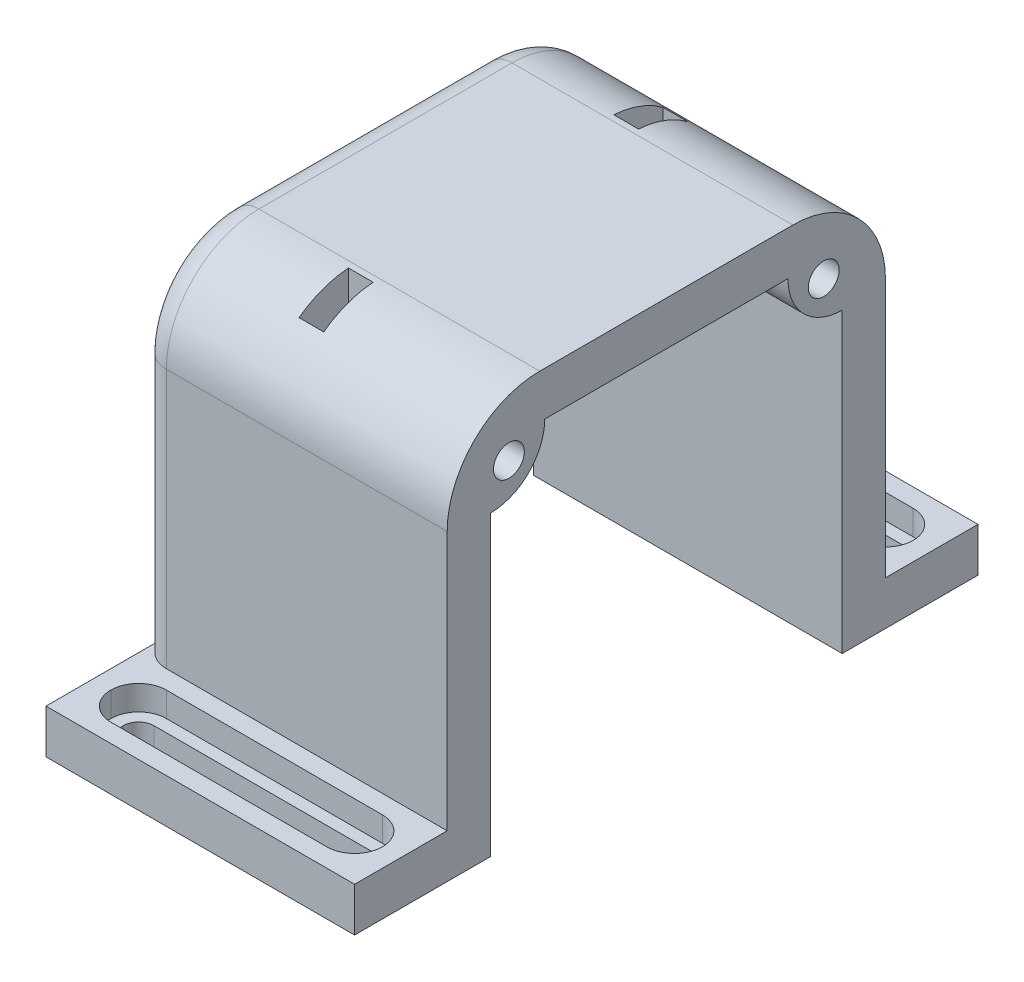
from build123d import *

# Parameters (mm, degrees)
BOSS_EXTRUDE1_DEPTH = 50
SKETCH2_R           = 2.5
CUT_EXTRUDE1_DEPTH  = 50
FILLET1_R           = 15
SKETCH3_W           = 4
SKETCH3_H           = 8
CUT_EXTRUDE2_DEPTH  = 14.54
SKETCH4_W           = 44
SKETCH4_H           = 9
CUT_EXTRUDE3_DEPTH  = 4
SKETCH5_W           = 40
SKETCH5_H           = 5
CUT_EXTRUDE4_DEPTH  = 94.654951818
FILLET2_R           = 2.5
FILLET3_R           = 4.5
FILLET4_R           = 4.5


with BuildPart() as part:
    # Sketch1 → Boss-Extrude1 (new body)
    with BuildSketch(Plane(origin=(0, 0, 0), x_dir=(0, 0, -1), z_dir=(1, 0, 0))):
        with BuildLine():
            Line((35.5, 35.62933491), (-35.5, 35.62933491))
            Line((-35.5, 35.62933491), (-35.5, -21.37066509))
            Line((-35.5, -21.37066509), (-50.5, -21.37066509))
            Line((-50.5, -21.37066509), (-50.5, -28.5))
            Line((-50.5, -28.5), (-28.5, -28.5))
            Line((-28.5, -28.5), (-28.5, 19.7))
            ThreePointArc((-28.5, 19.7), (-22.277460326, 22.277460326), (-19.7, 28.5))
            Line((-19.7, 28.5), (19.7, 28.5))
            ThreePointArc((19.7, 28.5), (22.277460326, 22.277460326), (28.5, 19.7))
            Line((28.5, 19.7), (28.5, -28.5))
            Line((28.5, -28.5), (50.5, -28.5))
            Line((50.5, -28.5), (50.5, -21.37066509))
            Line((50.5, -21.37066509), (35.5, -21.37066509))
            Line((35.5, -21.37066509), (35.5, 35.62933491))
        make_face()
    extrude(amount=BOSS_EXTRUDE1_DEPTH)

    # Sketch2 → Cut-Extrude1 (cut)
    with BuildSketch(Plane.ZY):
        with Locations((-25.5, 25.592902541)):
            Circle(SKETCH2_R)
        with Locations(Location((25.5, 25.592902541, 0), (0, 0, 180))):
            Circle(SKETCH2_R)
    extrude(amount=-CUT_EXTRUDE1_DEPTH, mode=Mode.SUBTRACT)

    # Fillet1
    fillet1_edges = [part.edges().sort_by_distance(p)[0] for p in [
        (25, 35.62933491, 35.5),
        (25, 35.62933491, -35.5),
    ]]
    fillet(fillet1_edges, radius=FILLET1_R)

    # Sketch3 → Cut-Extrude2 (cut)
    with BuildSketch(Plane(origin=(0, 35.62933491, 0), x_dir=(1, 0, 0), z_dir=(0, 1, 0))):
        with Locations((22, 25.5)):
            Rectangle(SKETCH3_W, SKETCH3_H)
        with Locations((22, -25.5)):
            Rectangle(SKETCH3_W, SKETCH3_H)
    extrude(amount=-CUT_EXTRUDE2_DEPTH, mode=Mode.SUBTRACT)

    # Sketch4 → Cut-Extrude3 (cut)
    with BuildSketch(Plane(origin=(0, -21.37066509, 0), x_dir=(1, 0, 0), z_dir=(0, 1, 0))):
        with Locations((25, -43)):
            Rectangle(SKETCH4_W, SKETCH4_H)
        with Locations((25, 43)):
            Rectangle(SKETCH4_W, SKETCH4_H)
    extrude(amount=-CUT_EXTRUDE3_DEPTH, mode=Mode.SUBTRACT)

    # Sketch5 → Cut-Extrude4 (cut, through all)
    with BuildSketch(Plane(origin=(0, -25.37066509, 0), x_dir=(1, 0, 0), z_dir=(0, 1, 0))):
        with Locations((25, -43)):
            Rectangle(SKETCH5_W, SKETCH5_H)
        with Locations((25, 43)):
            Rectangle(SKETCH5_W, SKETCH5_H)
    extrude(amount=-CUT_EXTRUDE4_DEPTH, mode=Mode.SUBTRACT)

    # Fillet2
    fillet2_edges = [part.edges().sort_by_distance(p)[0] for p in [
        (45, -26.935332545, 40.5),
        (45, -26.935332545, 45.5),
        (5, -26.935332545, 45.5),
        (5, -26.935332545, 40.5),
        (5, -26.935332545, -45.5),
        (5, -26.935332545, -40.5),
        (45, -26.935332545, -45.5),
        (45, -26.935332545, -40.5),
    ]]
    fillet(fillet2_edges, radius=FILLET2_R - 0.0001)  # a hair under: the kernel refuses the full size

    # Fillet3
    fillet3_edges = [part.edges().sort_by_distance(p)[0] for p in [
        (3, -23.37066509, 38.5),
        (3, -23.37066509, 47.5),
        (47, -23.37066509, 47.5),
        (47, -23.37066509, 38.5),
        (47, -23.37066509, -47.5),
        (47, -23.37066509, -38.5),
        (3, -23.37066509, -47.5),
        (3, -23.37066509, -38.5),
    ]]
    fillet(fillet3_edges, radius=FILLET3_R - 0.0001)  # a hair under: the kernel refuses the full size

    # Fillet4
    fillet4_edges = [part.edges().sort_by_distance(p)[0] for p in [
        (0, -0.37066509, -35.5),
        (0, -0.37066509, 35.5),
        (0, 35.62933491, 0),
        (0, 31.235936628, -31.106601718),
        (0, 31.235936628, 31.106601718),
    ]]
    fillet(fillet4_edges, radius=FILLET4_R)


solid = part.part
